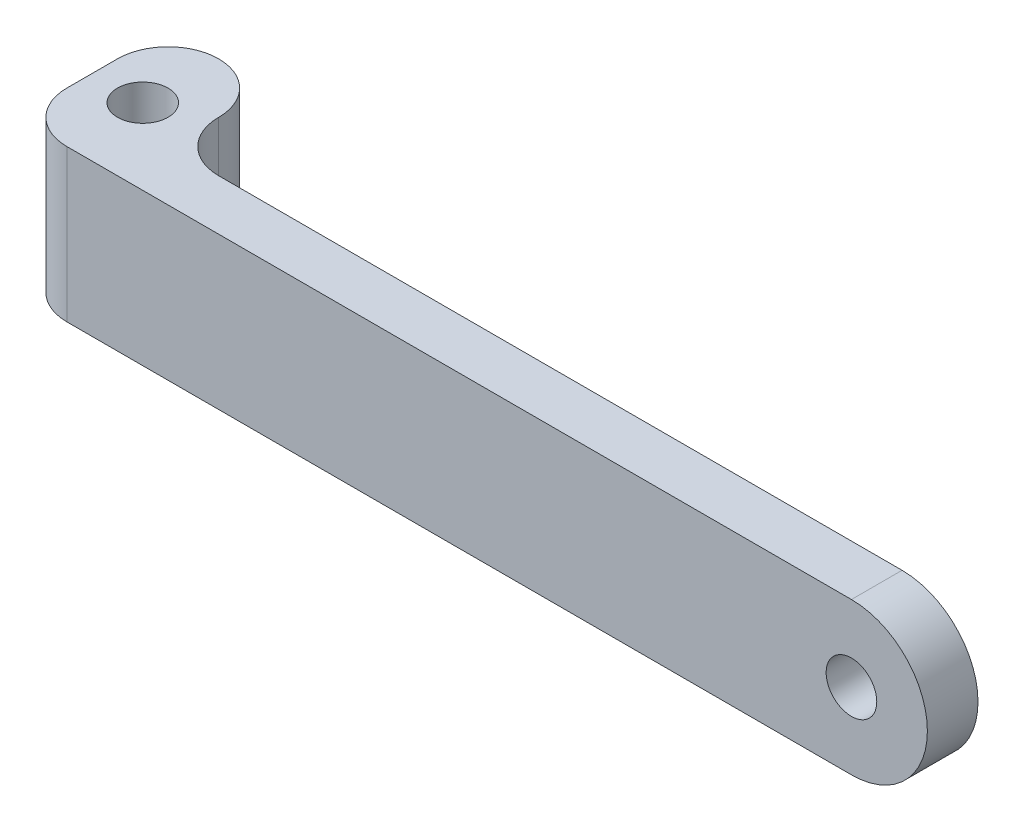
from build123d import *

# Parameters (mm, degrees)
SKETCH1_R           = 7.5
SKETCH1_R_2         = 2.5
BOSS_EXTRUDE1_DEPTH = 5
SKETCH3_W           = 10
SKETCH3_H           = 15
BOSS_EXTRUDE2_DEPTH = 15
SKETCH4_R           = 2.5
CUT_EXTRUDE1_DEPTH  = 15
FILLET1_R           = 5


with BuildPart() as part:
    # Sketch1 → Boss-Extrude1 (new body)
    # profile 1 of 3: a face of its own
    with BuildSketch(Plane.XY):
        Circle(SKETCH1_R)
        Circle(SKETCH1_R_2, mode=Mode.SUBTRACT)
    # profile 2 of 3: a face of its own
    with BuildSketch(Plane.XY):
        with BuildLine():
            Line((75, 7.5), (0, 7.5))
            ThreePointArc((0, 7.5), (5.303300859, 5.303300859), (7.5, 0))
            ThreePointArc((7.5, 0), (5.303300859, -5.303300859), (0, -7.5))
            Line((0, -7.5), (75, -7.5))
            ThreePointArc((75, -7.5), (67.5, 0), (75, 7.5))
        make_face()
    # profile 3 of 3: a face of its own
    with BuildSketch(Plane.XY):
        with Locations((75, 0)):
            Circle(SKETCH1_R)
        with Locations((75, 0)):
            Circle(SKETCH1_R_2, mode=Mode.SUBTRACT)
    extrude(amount=BOSS_EXTRUDE1_DEPTH)

    # Sketch3 → Boss-Extrude2 (add)
    with BuildSketch(Plane(origin=(0, 7.5, 0), x_dir=(1, 0, 0), z_dir=(0, 1, 0))):
        with Locations((-2.5, 2.5)):
            Rectangle(SKETCH3_W, SKETCH3_H)
    extrude(amount=-BOSS_EXTRUDE2_DEPTH)

    # Sketch4 → Cut-Extrude1 (cut)
    with BuildSketch(Plane(origin=(0, 7.5, 0), x_dir=(1, 0, 0), z_dir=(0, 1, 0))):
        with Locations(Location((-2.5, 2.5, 0), (0, 0, 180))):
            Circle(SKETCH4_R)
    extrude(amount=-CUT_EXTRUDE1_DEPTH, mode=Mode.SUBTRACT)

    # Fillet1
    fillet1_edges = [part.edges().sort_by_distance(p)[0] for p in [
        (-7.5, -3.75, 5),
        (2.5, 0, 0),
        (2.5, 0, -10),
        (-7.5, 0, -10),
    ]]
    fillet(fillet1_edges, radius=FILLET1_R - 0.0001)  # a hair under: the kernel refuses the full size


solid = part.part
